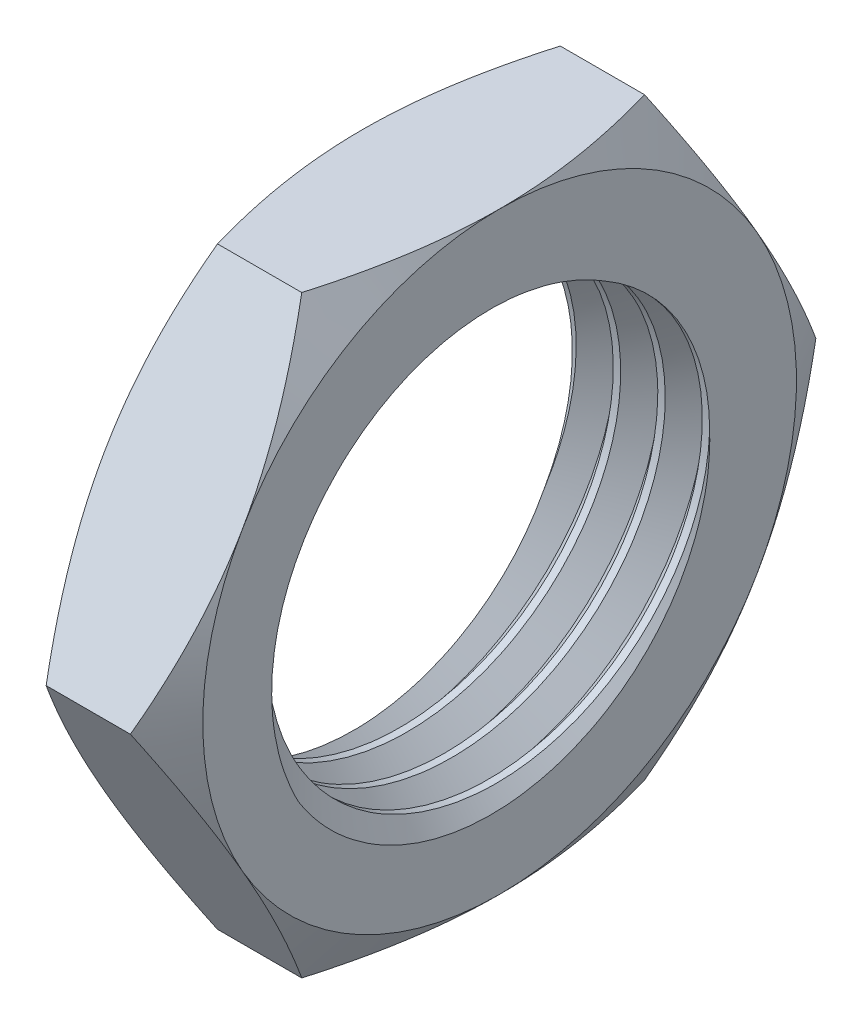
from build123d import *

# Parameters (mm, degrees)
BOSS_EXTRUDE1_DEPTH = 1.85
SKETCH3_R           = 2.83
CUT_EXTRUDE1_DEPTH  = 7.384029553
CUT_SWEEP1_PITCH    = 0.6


with BuildPart() as part:
    # Sketch1 → Boss-Extrude1 (new body)
    with BuildSketch(Plane(origin=(0, 0, 0), x_dir=(0, 0, -1), z_dir=(1, 0, 0))):
        Polygon((4.618802154, 0), (2.309401077, 4), (-2.309401077, 4), (-4.618802154, 0), (-2.309401077, -4), (2.309401077, -4), align=None)
    extrude(amount=BOSS_EXTRUDE1_DEPTH)

    # Sketch2 → Cut-Revolve1 (revolve, cut)
    with BuildSketch(Plane.XY):
        Polygon((-0.329700538, 3.428941916), (-0.329700538, 5.428941916), (0.825, 5.428941916), align=None)
        Polygon((1.025, 5.428941916), (2.179700538, 3.428941916), (2.179700538, 5.428941916), align=None)
    revolve(axis=Axis((0, 0, 0), (1, 0, 0)), mode=Mode.SUBTRACT)

    # Sketch3 → Cut-Extrude1 (cut, through all)
    with BuildSketch(Plane(origin=(1.85, 0, 0), x_dir=(0, 0, -1), z_dir=(1, 0, 0))):
        Circle(SKETCH3_R)
    extrude(amount=-CUT_EXTRUDE1_DEPTH, mode=Mode.SUBTRACT)

    # Cut-Sweep1: the profile of Sketch5 profile screwed along a right-hand helix of 5 turns, 6 arcs to a turn; built about Z, then put on its axis
    cut_sweep1_z = Axis((0, 0, 0), (0, 0, 1))
    cut_sweep1_corners = [(2.8297, 0, 0.00025), (3.13, 0, -0.25), (2.8297, 0, -0.50025)]
    with BuildLine(mode=Mode.PRIVATE) as cut_sweep1_profile:
        Line(cut_sweep1_corners[0], cut_sweep1_corners[1])
        Line(cut_sweep1_corners[1], cut_sweep1_corners[2])
        Line(cut_sweep1_corners[2], cut_sweep1_corners[0])
    cut_sweep1_cap = Face(cut_sweep1_profile.wire())
    cut_sweep1_turn_angles = [0, 30, 60, 90, 120, 150, 180, 210, 240, 270, 300, 330, 360]
    cut_sweep1_turn_weights = [1, 0.8660254037844387, 1, 0.8660254037844387, 1, 0.8660254037844387, 1, 0.8660254037844387, 1, 0.8660254037844387, 1, 0.8660254037844387, 1]
    cut_sweep1_turn_rails = [Edge.make_bspline([Vector(p[0], p[1], 0).rotate(cut_sweep1_z, cut_sweep1_turn_angles[k]) / cut_sweep1_turn_weights[k] + Vector(0, 0, p[2] + CUT_SWEEP1_PITCH * cut_sweep1_turn_angles[k] / 360) for k in range(13)], [0, 0, 0, 1, 1, 2, 2, 3, 3, 4, 4, 5, 5, 6, 6, 6], 2, cut_sweep1_turn_weights) for p in cut_sweep1_corners]
    cut_sweep1_turn_sides = [Face.make_surface_from_curves(cut_sweep1_turn_rails[p[0]], cut_sweep1_turn_rails[p[1]]) for p in [(0, 1), (1, 2), (2, 0)]]
    cut_sweep1 = Plane(origin=(1.85, 0, 0), x_dir=(0, 0, -1), z_dir=(-1, 0, 0)) * Solid(Shell([*[p.moved(Location((0, 0, CUT_SWEEP1_PITCH * i))) for i in range(5) for p in cut_sweep1_turn_sides], cut_sweep1_cap, cut_sweep1_cap.rotate(cut_sweep1_z, 1800).moved(Location((0, 0, CUT_SWEEP1_PITCH * 1800 / 360)))]))
    add(cut_sweep1, mode=Mode.SUBTRACT)


solid = part.part
